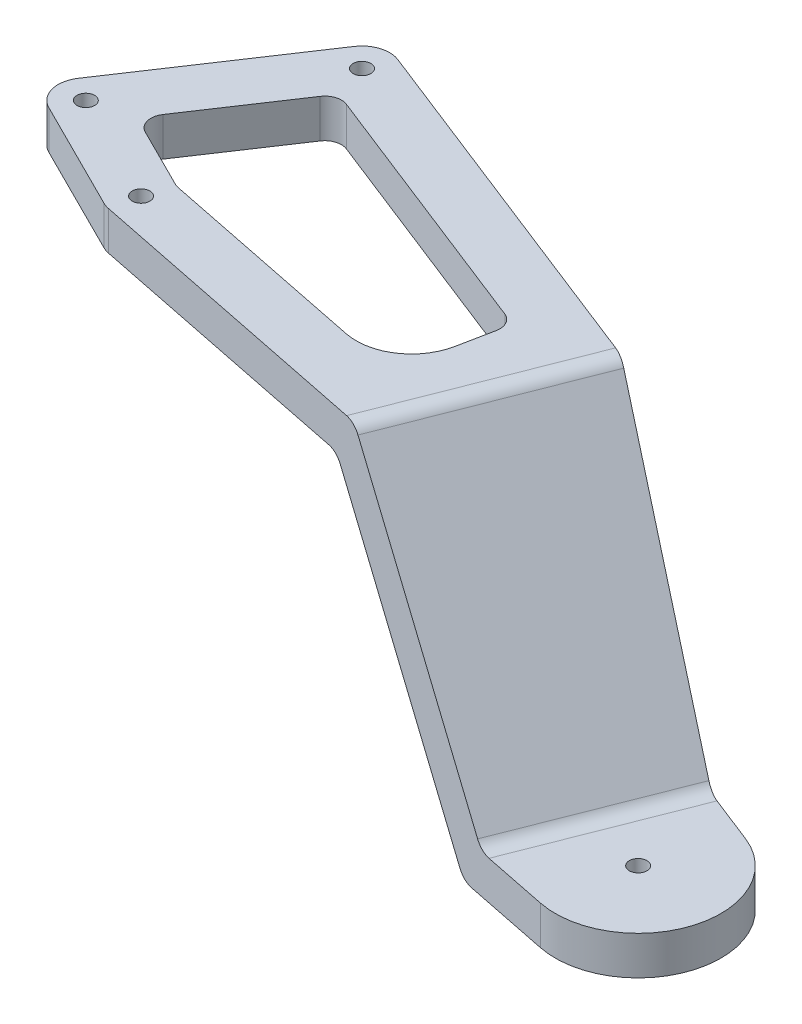
from build123d import *

# Parameters (mm, degrees)
BOSS_EXTRUDE1_DEPTH     = 17
SKETCH2_R               = 1.6
CUT_EXTRUDE1_DEPTH      = 125.655525349
BOSS_EXTRUDE2_DEPTH     = 40
CUT_EXTRUDE8_DEPTH      = 137.011028965
CUT_EXTRUDE8_DEPTH_BACK = 137.011028965
FILLET3_R               = 3
FILLET4_R               = 10
SKETCH4_R               = 1.6
CUT_EXTRUDE2_DEPTH      = 137.011028965
CUT_EXTRUDE3_DEPTH      = 132.524601131
CUT_EXTRUDE4_DEPTH      = 132.524601131
FILLET2_R               = 3


with BuildPart() as part:
    # Sketch1 → Boss-Extrude1 (new body)
    with BuildSketch(Plane(origin=(0, 0, 0), x_dir=(1, 0, 0), z_dir=(0, 1, 0))):
        with BuildLine():
            Line((1.827105745, 44.65421149), (105.481317235, 3.962634471))
            ThreePointArc((105.481317235, 3.962634471), (114.387686742, -14.241988945), (97.02970297, -24.702970297))
            Line((97.02970297, -24.702970297), (-0.99009901, -4.900990099))
            ThreePointArc((-0.99009901, -4.900990099), (-1.627272972, -4.727788349), (-2.236067977, -4.472135955))
            Line((-2.236067977, -4.472135955), (-22.236067977, 5.527864045))
            ThreePointArc((-22.236067977, 5.527864045), (-24.832498244, 8.716660324), (-24.160251472, 12.773500981))
            Line((-24.160251472, 12.773500981), (-4.160251472, 42.773500981))
            ThreePointArc((-4.160251472, 42.773500981), (-1.498385882, 44.770203324), (1.827105745, 44.65421149))
        make_face()
    extrude(amount=BOSS_EXTRUDE1_DEPTH)

    # Sketch2 → Cut-Extrude1 (cut, through all)
    with BuildSketch(Plane(origin=(0, 17, 0), x_dir=(1, 0, 0), z_dir=(0, 1, 0))):
        with Locations((0, 40)):
            Circle(SKETCH2_R)
        Circle(SKETCH2_R)
        with Locations((100, -10)):
            Circle(SKETCH2_R)
        with Locations((-20, 10)):
            Circle(SKETCH2_R)
    extrude(amount=-CUT_EXTRUDE1_DEPTH, mode=Mode.SUBTRACT)

    # Sketch3 → Boss-Extrude2 (add)
    with BuildSketch(Plane(origin=(0, 17, 0), x_dir=(1, 0, 0), z_dir=(0, 1, 0))):
        with BuildLine():
            Line((-0.99009901, -4.900990099), (97.02970297, -24.702970297))
            ThreePointArc((97.02970297, -24.702970297), (114.387686742, -14.241988945), (105.481317235, 3.962634471))
            Line((105.481317235, 3.962634471), (1.827105745, 44.65421149))
            ThreePointArc((1.827105745, 44.65421149), (-1.498385882, 44.770203324), (-4.160251472, 42.773500981))
            Line((-4.160251472, 42.773500981), (-24.160251472, 12.773500981))
            ThreePointArc((-24.160251472, 12.773500981), (-24.832498244, 8.716660324), (-22.236067977, 5.527864045))
            Line((-22.236067977, 5.527864045), (-2.236067977, -4.472135955))
            ThreePointArc((-2.236067977, -4.472135955), (-1.627272972, -4.727788349), (-0.99009901, -4.900990099))
        make_face()
    extrude(amount=BOSS_EXTRUDE2_DEPTH)

    # Sketch10 → Cut-Extrude8 (cut, two sides: drawn at the far end of the back side and taken through both)
    with BuildSketch(Plane(origin=(0, 57, 0), x_dir=(1, 0, 0), z_dir=(0, 1, 0)).offset(-CUT_EXTRUDE8_DEPTH_BACK)):
        Polygon((53.743516405, 13.530406204), (50, -5), (1.641587269, 4.769376309), (-12.697975934, 11.939157911), (1.924577813, 33.872988531), align=None)
    extrude(amount=CUT_EXTRUDE8_DEPTH + CUT_EXTRUDE8_DEPTH_BACK, mode=Mode.SUBTRACT)

    # Fillet3
    fillet3_edges = [part.edges().sort_by_distance(p)[0] for p in [
        (53.743516405, 28.5, -13.530406204),
        (1.641587269, 28.5, -4.769376309),
        (-12.697975934, 28.5, -11.939157911),
        (1.924577813, 28.5, -33.872988531),
    ]]
    fillet(fillet3_edges, radius=FILLET3_R)

    # Fillet4
    fillet4_edges = [part.edges().sort_by_distance(p)[0] for p in [
        (50, 28.5, 5),
    ]]
    fillet(fillet4_edges, radius=FILLET4_R)

    # Sketch4 → Cut-Extrude2 (cut, through all)
    with BuildSketch(Plane.XZ):
        with Locations((100, 10)):
            Circle(SKETCH4_R)
        with Locations((0, -40)):
            Circle(SKETCH4_R)
        with Locations((-20, -10)):
            Circle(SKETCH4_R)
        Circle(SKETCH4_R)
    extrude(amount=-CUT_EXTRUDE2_DEPTH, mode=Mode.SUBTRACT)

    # Sketch5 → Cut-Extrude3 (cut, through all)
    with BuildSketch(Plane(origin=(15.43308423, 0, -39.312906844), x_dir=(-0.9308422980528035, 0, -0.365421149026402), z_dir=(0.36542114902640194, 0, -0.9308422980528034))):
        Polygon((27.157091407, 50), (-52.842908593, 50), (-81.842908593, 0), (28.157091407, 0), (28.157091407, 50), align=None)
    extrude(amount=-CUT_EXTRUDE3_DEPTH, mode=Mode.SUBTRACT)

    # Sketch6 → Cut-Extrude4 (cut, through all)
    with BuildSketch(Plane(origin=(15.43308423, 0, -39.312906844), x_dir=(-0.9308422980528035, 0, -0.365421149026402), z_dir=(0.36542114902640194, 0, -0.9308422980528034))):
        Polygon((-111.738441296, 7), (-85.875102362, 7), (-56.875102362, 57), (-112.738441296, 57), (-112.738441296, 7), align=None)
    extrude(amount=-CUT_EXTRUDE4_DEPTH, mode=Mode.SUBTRACT)

    # Fillet2
    fillet2_edges = [part.edges().sort_by_distance(p)[0] for p in [
        (85.611733746, 0, 5.888782351),
        (57.68184528, 50, -2.325516258),
        (61.565249495, 57, -1.183390615),
        (89.495137961, 7, 7.030907995),
    ]]
    fillet(fillet2_edges, radius=FILLET2_R)


solid = part.part
